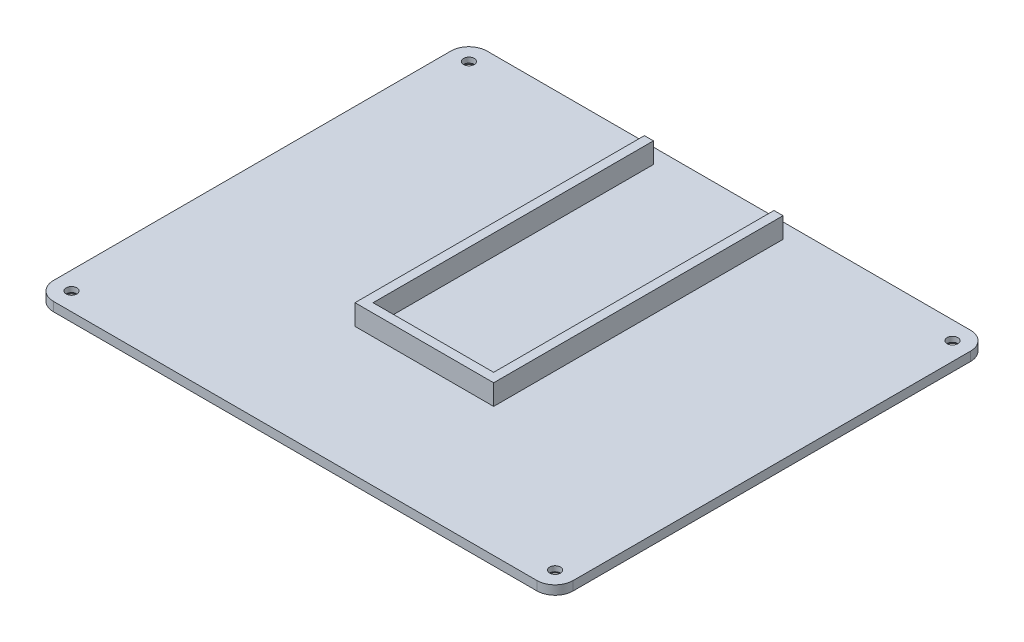
from build123d import *

# Parameters (mm, degrees)
SKETCH1_W                      = 86.201
SKETCH1_H                      = 71.913
BOSS_EXTRUDE1_DEPTH            = 1.5
FILLET1_R                      = 3
F_2_56_TAPPED_HOLE1_AT_2_COUNT = 2
F_2_56_TAPPED_HOLE1_AT_2_PITCH = 80.201
F_2_56_TAPPED_HOLE1_AT_3_COUNT = 2
F_2_56_TAPPED_HOLE1_AT_3_PITCH = 103.811001199
F_2_56_TAPPED_HOLE1_AT_4_COUNT = 2
F_2_56_TAPPED_HOLE1_AT_4_PITCH = 65.913
BOSS_EXTRUDE2_DEPTH            = 3.4


with BuildPart() as part:
    # Sketch1 → Boss-Extrude1 (new body)
    with BuildSketch(Plane(origin=(0, 0, 0), x_dir=(1, 0, 0), z_dir=(0, 1, 0))):
        Rectangle(SKETCH1_W, SKETCH1_H)
    extrude(amount=BOSS_EXTRUDE1_DEPTH)

    # Fillet1
    fillet1_edges = [part.edges().sort_by_distance(p)[0] for p in [
        (-43.1005, 0.75, 35.9565),
        (-43.1005, 0.75, -35.9565),
        (43.1005, 0.75, -35.9565),
        (43.1005, 0.75, 35.9565),
    ]]
    fillet(fillet1_edges, radius=FILLET1_R)

    # Sketch4 → #2-56 Tapped Hole1 (revolve, cut)
    with BuildSketch(Plane(origin=(-40.1005, 0, 32.9565), x_dir=(0, 0, -1), z_dir=(1, 0, 0))):
        Polygon((0, 0), (0, 1.5), (0.889, 1.5), (0.889, 0.635), (1.524, 0), align=None)
    f_2_56_tapped_hole1 = revolve(axis=Axis((-40.1005, -6.35, 32.9565), (0, 1, 0)), mode=Mode.SUBTRACT)

    # #2-56 Tapped Hole1 at 2: #2-56 Tapped Hole1 ×2
    with Locations(*[(i * F_2_56_TAPPED_HOLE1_AT_2_PITCH, 0, 0) for i in range(1, F_2_56_TAPPED_HOLE1_AT_2_COUNT)]):
        add(f_2_56_tapped_hole1, mode=Mode.SUBTRACT)

    # #2-56 Tapped Hole1 at 3: #2-56 Tapped Hole1 ×2
    with Locations(*[Vector(0.7725674453907951, 0, -0.634932706924396) * (i * F_2_56_TAPPED_HOLE1_AT_3_PITCH) for i in range(1, F_2_56_TAPPED_HOLE1_AT_3_COUNT)]):
        add(f_2_56_tapped_hole1, mode=Mode.SUBTRACT)

    # #2-56 Tapped Hole1 at 4: #2-56 Tapped Hole1 ×2
    with Locations(*[(0, 0, -i * F_2_56_TAPPED_HOLE1_AT_4_PITCH) for i in range(1, F_2_56_TAPPED_HOLE1_AT_4_COUNT)]):
        add(f_2_56_tapped_hole1, mode=Mode.SUBTRACT)

    # Sketch5 → Boss-Extrude2 (add)
    with BuildSketch(Plane(origin=(0, 1.5, 0), x_dir=(1, 0, 0), z_dir=(0, 1, 0))):
        Polygon((-10, -13.0435), (-10, 33.4565), (-11.5, 33.4565), (-11.5, -14.5435), (11.5, -14.5435), (11.5, 33.4565), (10, 33.4565), (10, -13.0435), align=None)
    extrude(amount=BOSS_EXTRUDE2_DEPTH)


solid = part.part
